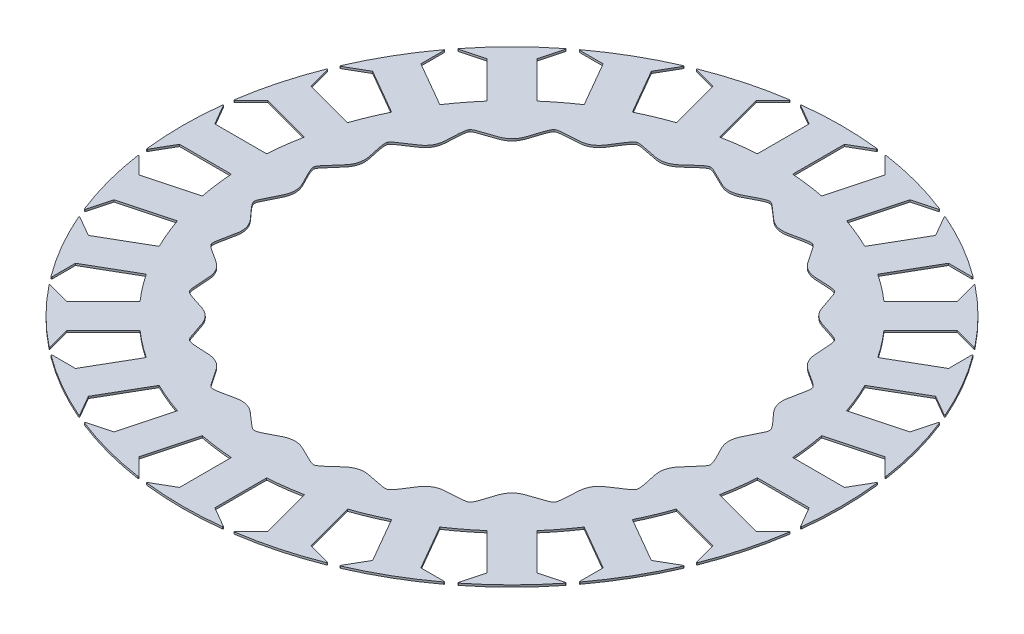
from build123d import *

# Parameters (mm, degrees)
BOSS_EXTRUDE1_DEPTH = 0.5
CIRPATTERN1_COUNT   = 24


# Read off the part's stored shape, not the designer's step: Boss-Extrude1
with BuildPart() as part:
    # Boss-Extrude1 outline → Boss-Extrude1 (new body)
    with BuildSketch(Plane(origin=(0, 0, 0), x_dir=(1, 0, 0), z_dir=(0, 1, 0))):
        with BuildLine():
            add(Edge.make_bspline(
                [(-7.519100211, -57.113236354), (-6.826282564, -57.200179205), (-3, -55.606064219), (0, -51.606064219), (3, -55.606064219), (6.826282564, -57.200179205), (7.519100211, -57.113236354)],
                knots=[0, 0, 0, 0, 0, 0, 0.5, 1, 1, 1, 1, 1, 1], degree=5))
            Line((-7.519100211, -57.113236354), (-8.614728687, -65.435360851))
            ThreePointArc((-8.614728687, -65.435360851), (-6.519623436, -65.677199318), (-4.417860937, -65.85197419))
            Line((-4.417860937, -65.85197419), (-4.417860938, -78.825077913))
            Line((-4.417860938, -78.825077913), (-9.515106999, -81.767974299))
            ThreePointArc((-9.515106999, -81.767974299), (-9.563028572, -81.874858987), (-9.476593779, -81.953914918))
            ThreePointArc((-9.476593779, -81.953914918), (0, -82.5), (9.476593779, -81.953914918))
            ThreePointArc((9.476593779, -81.953914918), (9.563028572, -81.874858987), (9.515106999, -81.767974299))
            Line((9.515106999, -81.767974299), (4.417860937, -78.825077913))
            Line((4.417860937, -78.825077913), (4.417860938, -65.85197419))
            ThreePointArc((4.417860938, -65.85197419), (6.519623436, -65.677199318), (8.614728687, -65.435360851))
            Line((8.614728687, -65.435360851), (7.519100211, -57.113236354))
        make_face()
    extrude(amount=BOSS_EXTRUDE1_DEPTH)


with BuildPart() as cirpattern1_1:
    # CirPattern1: pattern copy
    add(part.part.rotate(Axis((0, 55.396875, 0), (0, -1, 0)), 1 * 360 / CIRPATTERN1_COUNT))


with BuildPart() as cirpattern1_2:
    # CirPattern1: pattern copy
    add(part.part.rotate(Axis((0, 55.396875, 0), (0, -1, 0)), 2 * 360 / CIRPATTERN1_COUNT))


with BuildPart() as cirpattern1_3:
    # CirPattern1: pattern copy
    add(part.part.rotate(Axis((0, 55.396875, 0), (0, -1, 0)), 3 * 360 / CIRPATTERN1_COUNT))


with BuildPart() as cirpattern1_4:
    # CirPattern1: pattern copy
    add(part.part.rotate(Axis((0, 55.396875, 0), (0, -1, 0)), 4 * 360 / CIRPATTERN1_COUNT))


with BuildPart() as cirpattern1_5:
    # CirPattern1: pattern copy
    add(part.part.rotate(Axis((0, 55.396875, 0), (0, -1, 0)), 5 * 360 / CIRPATTERN1_COUNT))


with BuildPart() as cirpattern1_6:
    # CirPattern1: pattern copy
    add(part.part.rotate(Axis((0, 55.396875, 0), (0, -1, 0)), 6 * 360 / CIRPATTERN1_COUNT))


with BuildPart() as cirpattern1_7:
    # CirPattern1: pattern copy
    add(part.part.rotate(Axis((0, 55.396875, 0), (0, -1, 0)), 7 * 360 / CIRPATTERN1_COUNT))


with BuildPart() as cirpattern1_8:
    # CirPattern1: pattern copy
    add(part.part.rotate(Axis((0, 55.396875, 0), (0, -1, 0)), 8 * 360 / CIRPATTERN1_COUNT))


with BuildPart() as cirpattern1_9:
    # CirPattern1: pattern copy
    add(part.part.rotate(Axis((0, 55.396875, 0), (0, -1, 0)), 9 * 360 / CIRPATTERN1_COUNT))


with BuildPart() as cirpattern1_10:
    # CirPattern1: pattern copy
    add(part.part.rotate(Axis((0, 55.396875, 0), (0, -1, 0)), 10 * 360 / CIRPATTERN1_COUNT))


with BuildPart() as cirpattern1_11:
    # CirPattern1: pattern copy
    add(part.part.rotate(Axis((0, 55.396875, 0), (0, -1, 0)), 11 * 360 / CIRPATTERN1_COUNT))


with BuildPart() as cirpattern1_12:
    # CirPattern1: pattern copy
    add(part.part.rotate(Axis((0, 55.396875, 0), (0, -1, 0)), 12 * 360 / CIRPATTERN1_COUNT))


with BuildPart() as cirpattern1_13:
    # CirPattern1: pattern copy
    add(part.part.rotate(Axis((0, 55.396875, 0), (0, -1, 0)), 13 * 360 / CIRPATTERN1_COUNT))


with BuildPart() as cirpattern1_14:
    # CirPattern1: pattern copy
    add(part.part.rotate(Axis((0, 55.396875, 0), (0, -1, 0)), 14 * 360 / CIRPATTERN1_COUNT))


with BuildPart() as cirpattern1_15:
    # CirPattern1: pattern copy
    add(part.part.rotate(Axis((0, 55.396875, 0), (0, -1, 0)), 15 * 360 / CIRPATTERN1_COUNT))


with BuildPart() as cirpattern1_16:
    # CirPattern1: pattern copy
    add(part.part.rotate(Axis((0, 55.396875, 0), (0, -1, 0)), 16 * 360 / CIRPATTERN1_COUNT))


with BuildPart() as cirpattern1_17:
    # CirPattern1: pattern copy
    add(part.part.rotate(Axis((0, 55.396875, 0), (0, -1, 0)), 17 * 360 / CIRPATTERN1_COUNT))


with BuildPart() as cirpattern1_18:
    # CirPattern1: pattern copy
    add(part.part.rotate(Axis((0, 55.396875, 0), (0, -1, 0)), 18 * 360 / CIRPATTERN1_COUNT))


with BuildPart() as cirpattern1_19:
    # CirPattern1: pattern copy
    add(part.part.rotate(Axis((0, 55.396875, 0), (0, -1, 0)), 19 * 360 / CIRPATTERN1_COUNT))


with BuildPart() as cirpattern1_20:
    # CirPattern1: pattern copy
    add(part.part.rotate(Axis((0, 55.396875, 0), (0, -1, 0)), 20 * 360 / CIRPATTERN1_COUNT))


with BuildPart() as cirpattern1_21:
    # CirPattern1: pattern copy
    add(part.part.rotate(Axis((0, 55.396875, 0), (0, -1, 0)), 21 * 360 / CIRPATTERN1_COUNT))


with BuildPart() as cirpattern1_22:
    # CirPattern1: pattern copy
    add(part.part.rotate(Axis((0, 55.396875, 0), (0, -1, 0)), 22 * 360 / CIRPATTERN1_COUNT))


with BuildPart() as cirpattern1_23:
    # CirPattern1: pattern copy
    add(part.part.rotate(Axis((0, 55.396875, 0), (0, -1, 0)), 23 * 360 / CIRPATTERN1_COUNT))


with BuildPart() as part_1:
    add(part.part)

    # Combine1: union CirPattern1_1, CirPattern1_2, CirPattern1_3, CirPattern1_4, CirPattern1_5, CirPattern1_6, CirPattern1_7, CirPattern1_8, CirPattern1_9, CirPattern1_10, CirPattern1_11, CirPattern1_12, CirPattern1_13, CirPattern1_14, CirPattern1_15, CirPattern1_16, CirPattern1_17, CirPattern1_18, CirPattern1_19, CirPattern1_20, CirPattern1_21, CirPattern1_22, CirPattern1_23
    add(cirpattern1_1.part)
    add(cirpattern1_2.part)
    add(cirpattern1_3.part)
    add(cirpattern1_4.part)
    add(cirpattern1_5.part)
    add(cirpattern1_6.part)
    add(cirpattern1_7.part)
    add(cirpattern1_8.part)
    add(cirpattern1_9.part)
    add(cirpattern1_10.part)
    add(cirpattern1_11.part)
    add(cirpattern1_12.part)
    add(cirpattern1_13.part)
    add(cirpattern1_14.part)
    add(cirpattern1_15.part)
    add(cirpattern1_16.part)
    add(cirpattern1_17.part)
    add(cirpattern1_18.part)
    add(cirpattern1_19.part)
    add(cirpattern1_20.part)
    add(cirpattern1_21.part)
    add(cirpattern1_22.part)
    add(cirpattern1_23.part)


solid = part_1.part
